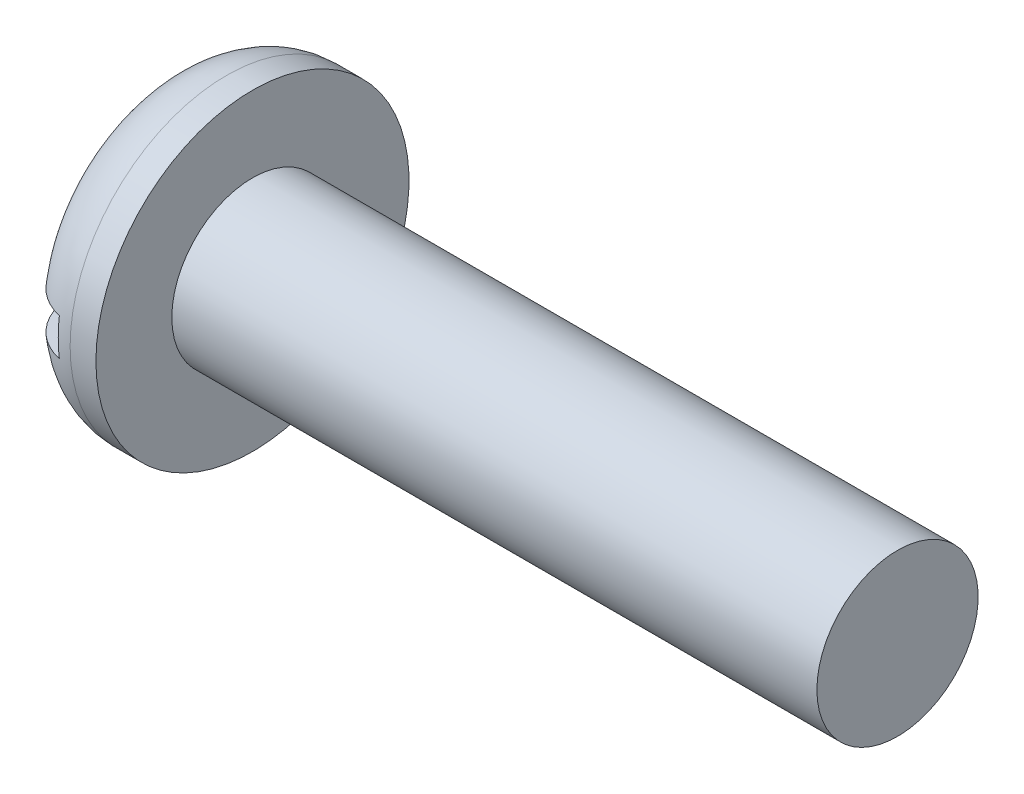
from build123d import *

# Parameters (mm, degrees)
SKETCH2_W  = 18.4912
SKETCH2_H  = 2.2098
SLOT_DEPTH = 2.8448


with BuildPart() as part:
    # BodySke → Base-Revolve (revolve)
    with BuildSketch(Plane.XY):
        with BuildLine():
            Line((5.1562, 4.7625), (5.1562, 9.2456))
            Line((5.1562, 9.2456), (3.6322, 9.2456))
            ThreePointArc((3.6322, 9.2456), (1.063846749, 8.181753251), (0, 5.6134))
            Line((0, 5.6134), (0, 0))
            Line((0, 0), (43.2562, 0))
            Line((43.2562, 0), (43.2562, 4.7625))
            Line((43.2562, 4.7625), (5.1562, 4.7625))
        make_face()
    revolve(axis=Axis((-25.4, 0, 0), (1, 0, 0)))

    # Sketch2 → Slot (cut)
    with BuildSketch(Plane(origin=(0, 0, 0), x_dir=(0, 0, -1), z_dir=(1, 0, 0))):
        Rectangle(SKETCH2_W, SKETCH2_H)
    extrude(amount=SLOT_DEPTH, mode=Mode.SUBTRACT)


solid = part.part
